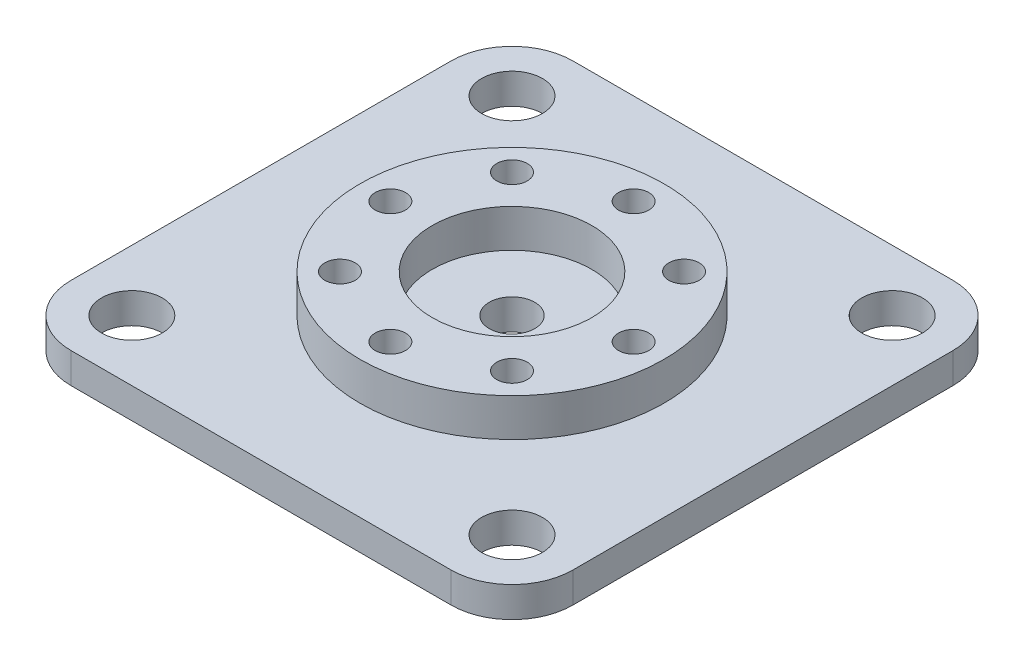
from build123d import *

# Parameters (mm, degrees)
SKETCH_1_W             = 33
SKETCH_1_H             = 33
SM_BASE_FLANGE_1_DEPTH = 2
SKETCH_6_R             = 1
SKETCH_6_R_2           = 2
SKETCH_6_R_3           = 1.5
CUT_EXTRUDE_1_DEPTH    = 24.420076857
FILLET_1_R             = 4
SM_START               = 2.5
SKETCH_7_R             = 10
SKETCH_7_R_2           = 1
SKETCH_7_R_3           = 5.25
SM_BASE_FLANGE_2_DEPTH = 2.5


# Sheet-metal steps are written as plain solids
with BuildPart() as part:
    # Sketch 1 → 基体-法兰1 (new body)
    with BuildSketch(Plane(origin=(0, 0, 0), x_dir=(1, 0, 0), z_dir=(0, 1, 0))):
        Rectangle(SKETCH_1_W, SKETCH_1_H)
    extrude(amount=-SM_BASE_FLANGE_1_DEPTH)

    # 草图6 → 切除-拉伸1 (cut, through all)
    with BuildSketch(Plane(origin=(0, 0, 0), x_dir=(1, 0, 0), z_dir=(0, 1, 0))):
        with Locations(Location((0, 8, 0), (0, 0, 270))):
            Circle(SKETCH_6_R)
        with Locations(Location((5.656854249, 5.656854249, 0), (0, 0, 270))):
            Circle(SKETCH_6_R)
        with Locations(Location((8, 0, 0), (0, 0, 270))):
            Circle(SKETCH_6_R)
        with Locations(Location((5.656854249, -5.656854249, 0), (0, 0, 270))):
            Circle(SKETCH_6_R)
        with Locations(Location((0, -8, 0), (0, 0, 270))):
            Circle(SKETCH_6_R)
        with Locations(Location((-5.656854249, -5.656854249, 0), (0, 0, 270))):
            Circle(SKETCH_6_R)
        with Locations(Location((-8, 0, 0), (0, 0, 270))):
            Circle(SKETCH_6_R)
        with Locations(Location((-5.656854249, 5.656854249, 0), (0, 0, 270))):
            Circle(SKETCH_6_R)
        with Locations(Location((-12.5, 12.5, 0), (0, 0, 270))):
            Circle(SKETCH_6_R_2)
        with Locations(Location((12.5, 12.5, 0), (0, 0, 270))):
            Circle(SKETCH_6_R_2)
        with Locations(Location((12.5, -12.5, 0), (0, 0, 270))):
            Circle(SKETCH_6_R_2)
        with Locations(Location((-12.5, -12.5, 0), (0, 0, 270))):
            Circle(SKETCH_6_R_2)
        with Locations(Location((0, 0, 0), (0, 0, 270))):
            Circle(SKETCH_6_R_3)
    extrude(amount=-CUT_EXTRUDE_1_DEPTH, mode=Mode.SUBTRACT)

    # 圆角1
    fillet_1_edges = [part.edges().sort_by_distance(p)[0] for p in [
        (-16.5, -1, -16.5),
        (16.5, -1, -16.5),
        (16.5, -1, 16.5),
        (-16.5, -1, 16.5),
    ]]
    fillet(fillet_1_edges, radius=FILLET_1_R)


with BuildPart() as body_2:
    # 草图7 → 基体-法兰2 (new body)
    with BuildSketch(Plane(origin=(0, 0, 0), x_dir=(1, 0, 0), z_dir=(0, 1, 0)).offset(SM_START)):
        with Locations(Location((0, 0, 0), (0, 0, 270))):
            Circle(SKETCH_7_R)
        with Locations(Location((5.656854249, 5.656854249, 0), (0, 0, 270))):
            Circle(SKETCH_7_R_2, mode=Mode.SUBTRACT)
        with Locations(Location((8, 0, 0), (0, 0, 270))):
            Circle(SKETCH_7_R_2, mode=Mode.SUBTRACT)
        with Locations(Location((5.656854249, -5.656854249, 0), (0, 0, 270))):
            Circle(SKETCH_7_R_2, mode=Mode.SUBTRACT)
        with Locations(Location((0, -8, 0), (0, 0, 270))):
            Circle(SKETCH_7_R_2, mode=Mode.SUBTRACT)
        with Locations(Location((-5.656854249, -5.656854249, 0), (0, 0, 270))):
            Circle(SKETCH_7_R_2, mode=Mode.SUBTRACT)
        with Locations(Location((-8, 0, 0), (0, 0, 270))):
            Circle(SKETCH_7_R_2, mode=Mode.SUBTRACT)
        with Locations(Location((-5.656854249, 5.656854249, 0), (0, 0, 270))):
            Circle(SKETCH_7_R_2, mode=Mode.SUBTRACT)
        with Locations(Location((0, 8, 0), (0, 0, 270))):
            Circle(SKETCH_7_R_2, mode=Mode.SUBTRACT)
        with Locations(Location((0, 0, 0), (0, 0, 270))):
            Circle(SKETCH_7_R_3, mode=Mode.SUBTRACT)
    extrude(amount=-SM_BASE_FLANGE_2_DEPTH)


solid = Compound([part.part, body_2.part])
